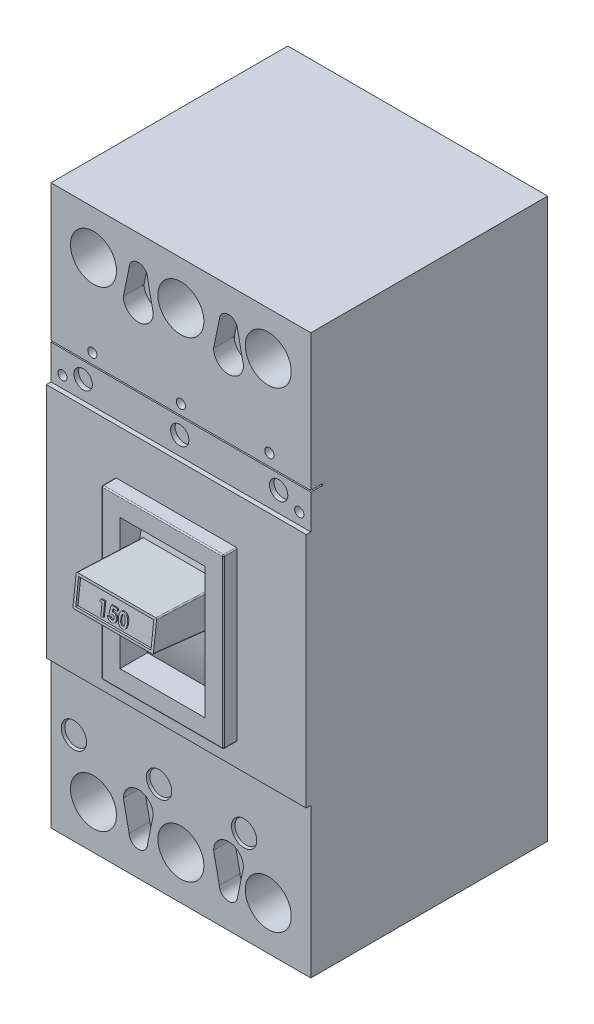
from build123d import *

# Parameters (mm, degrees)
CROQUIS1_W              = 113
CROQUIS1_H              = 243
SALIENTE_EXTRUIR1_DEPTH = 105
CROQUIS2_W              = 113
CROQUIS2_H              = 65
CORTAR_EXTRUIR1_DEPTH   = 2
CROQUIS3_W              = 113
CROQUIS3_H              = 75
CORTAR_EXTRUIR2_DEPTH   = 2
CROQUIS4_W              = 53
CROQUIS4_H              = 73
SALIENTE_EXTRUIR2_DEPTH = 6
CROQUIS5_W              = 37
CROQUIS5_H              = 57
CORTAR_EXTRUIR3_DEPTH   = 7
CORTAR_EXTRUIR4_DEPTH   = 37
SALIENTE_EXTRUIR3_DEPTH = 37
CORTAR_EXTRUIR5_DEPTH   = 1
CORTAR_EXTRUIR6_START   = -1
CORTAR_EXTRUIR6_DEPTH   = 1
CROQUIS11_W             = 32.724910956
CROQUIS11_H             = 10.881126431
CORTAR_EXTRUIR7_DEPTH   = 1
REDONDEO1_R             = 0.5
SALIENTE_EXTRUIR4_DEPTH = 0.5
REDONDEO2_R             = 0.5
CROQUIS13_R             = 10
CORTAR_EXTRUIR8_DEPTH   = 39
CORTAR_EXTRUIR9_DEPTH   = 9
CROQUIS15_R             = 3.5
CROQUIS15_R_2           = 2.5
CORTAR_EXTRUIR10_DEPTH  = 94
CROQUIS16_R             = 3.5
CROQUIS16_R_2           = 2.5
CORTAR_EXTRUIR11_DEPTH  = 94
CROQUIS17_R             = 4
CORTAR_EXTRUIR12_DEPTH  = 2
CROQUIS18_R             = 2
CORTAR_EXTRUIR13_DEPTH  = 10
CROQUIS19_W             = 113
CROQUIS19_H             = 0.6
CORTAR_EXTRUIR14_DEPTH  = 5
CROQUIS20_R             = 5.5
CORTAR_EXTRUIR15_DEPTH  = 5
CROQUIS21_R             = 5
SALIENTE_EXTRUIR5_DEPTH = 4


with BuildPart() as part:
    # Croquis1 → Saliente-Extruir1 (new body)
    with BuildSketch(Plane.XY):
        Rectangle(CROQUIS1_W, CROQUIS1_H)
    extrude(amount=SALIENTE_EXTRUIR1_DEPTH)

    # Croquis2 → Cortar-Extruir1 (cut)
    with BuildSketch(Plane.XY.offset(105)):
        with Locations((0, -89)):
            Rectangle(CROQUIS2_W, CROQUIS2_H)
    extrude(amount=-CORTAR_EXTRUIR1_DEPTH, mode=Mode.SUBTRACT)

    # Croquis3 → Cortar-Extruir2 (cut)
    with BuildSketch(Plane.XY.offset(105)):
        with Locations((0, 84)):
            Rectangle(CROQUIS3_W, CROQUIS3_H)
    extrude(amount=-CORTAR_EXTRUIR2_DEPTH, mode=Mode.SUBTRACT)

    # Croquis4 → Saliente-Extruir2 (add)
    with BuildSketch(Plane.XY.offset(105)):
        with Locations((0, -10)):
            Rectangle(CROQUIS4_W, CROQUIS4_H)
    extrude(amount=SALIENTE_EXTRUIR2_DEPTH)

    # Croquis5 → Cortar-Extruir3 (cut)
    with BuildSketch(Plane.XY.offset(111)):
        with Locations((0, -10)):
            Rectangle(CROQUIS5_W, CROQUIS5_H)
    extrude(amount=-CORTAR_EXTRUIR3_DEPTH, mode=Mode.SUBTRACT)

    # Croquis6 → Cortar-Extruir4 (cut)
    with BuildSketch(Plane(origin=(-18.5, 0, 0), x_dir=(0, 0, -1), z_dir=(1, 0, 0))):
        with BuildLine():
            Line((-104, 18.5), (-99, 18.5))
            ThreePointArc((-99, 18.5), (-104, -10), (-99, -38.5))
            Line((-99, -38.5), (-104, -38.5))
            Line((-104, -38.5), (-106.9692162, -38.5))
            Line((-106.9692162, -38.5), (-106.9692162, 18.5))
            Line((-106.9692162, 18.5), (-104, 18.5))
        make_face()
    extrude(amount=CORTAR_EXTRUIR4_DEPTH, mode=Mode.SUBTRACT)

    # Croquis7 → Saliente-Extruir3 (add)
    with BuildSketch(Plane(origin=(-18.5, 0, 0), x_dir=(0, 0, -1), z_dir=(1, 0, 0))):
        with BuildLine():
            Line((-102.227649558, 7.135893771), (-131, 8.457991718))
            Line((-131, 8.457991718), (-132.497021742, -4.45552546))
            Line((-132.497021742, -4.45552546), (-103.9700983, -7.762558242))
            ThreePointArc((-103.9700983, -7.762558242), (-103.433192986, -0.274231943), (-102.227649558, 7.135893771))
        make_face()
    extrude(amount=SALIENTE_EXTRUIR3_DEPTH)

    # Croquis9 → Cortar-Extruir5 (cut)
    with BuildSketch(Plane(origin=(18.5, 0, 0), x_dir=(0, 0, -1), z_dir=(1, 0, 0))):
        with BuildLine():
            Line((-131, 8.457991718), (-102.227649558, 7.135893771))
            ThreePointArc((-102.227649558, 7.135893771), (-103.52546689, -0.263440047), (-103.9700983, -7.762558242))
            Line((-103.9700983, -7.762558242), (-132.497021742, -4.45552546))
            Line((-132.497021742, -4.45552546), (-131, 8.457991718))
        make_face()
    extrude(amount=-CORTAR_EXTRUIR5_DEPTH, mode=Mode.SUBTRACT)

    # Croquis10 → Cortar-Extruir6 (cut)
    with BuildSketch(Plane.ZY.offset(18.5).offset(CORTAR_EXTRUIR6_START)):
        with BuildLine():
            Line((102.227649558, 7.135893771), (131, 8.457991718))
            Line((131, 8.457991718), (132.497021742, -4.45552546))
            Line((132.497021742, -4.45552546), (103.9700983, -7.762558242))
            ThreePointArc((103.9700983, -7.762558242), (103.52546689, -0.263440047), (102.227649558, 7.135893771))
        make_face()
    extrude(amount=CORTAR_EXTRUIR6_DEPTH, mode=Mode.SUBTRACT)

    # Croquis11 → Cortar-Extruir7 (cut)
    with BuildSketch(Plane(origin=(0, 15.097176807, 130.230341022), x_dir=(1, 0, 0), z_dir=(0, 0.11515551864956705, 0.9933474752192957))):
        with Locations((0, -13.183648225)):
            Rectangle(CROQUIS11_W, CROQUIS11_H)
    extrude(amount=-CORTAR_EXTRUIR7_DEPTH, mode=Mode.SUBTRACT)

    # Redondeo1
    # the kernel refuses this fillet: 0.5 mm, written as the material it takes off along each edge
    with BuildSketch(Plane(origin=(17.5, 8.515369043, 132.248682443), x_dir=(-1, 0, 0), z_dir=(0, -0.04590185976263014, -0.9989459541288167))) as redondeo1_piece_1_section:
        with BuildLine():
            CenterArc((REDONDEO1_R, -REDONDEO1_R), REDONDEO1_R, 90, 90)
            Line((0, -REDONDEO1_R), (0, 0))
            Line((0, 0), (REDONDEO1_R, 0))
        make_face()
    redondeo1_piece_1 = extrude(amount=31.302709819, mode=Mode.PRIVATE)
    redondeo1_piece_1 = redondeo1_piece_1 - Plane(origin=(17.386760277, -7.895107105, 38.27245671), x_dir=(0, 0.2287901044943887, 0.9734757768354829), z_dir=(1, 0, 0)) * Cylinder(65.697775302, 65, mode=Mode.PRIVATE)
    add(redondeo1_piece_1, mode=Mode.SUBTRACT)
    with BuildSketch(Plane(origin=(17.5, -7.90650264, 102.728413956), x_dir=(-1, 0, 0), z_dir=(0, 0.11515551864956763, 0.9933474752192957))) as redondeo1_piece_2_section:
        with BuildLine():
            CenterArc((REDONDEO1_R, -REDONDEO1_R), REDONDEO1_R, 90, 90)
            Line((0, -REDONDEO1_R), (0, 0))
            Line((0, 0), (REDONDEO1_R, 0))
        make_face()
    redondeo1_piece_2 = extrude(amount=31.217970453, mode=Mode.PRIVATE)
    redondeo1_piece_2 = redondeo1_piece_2 - Plane(origin=(17.38677693, -7.895107105, 38.27245671), x_dir=(0, 0.2287901044943887, 0.9734757768354829), z_dir=(1, 0, 0)) * Cylinder(65.697775302, 65, mode=Mode.PRIVATE)
    add(redondeo1_piece_2, mode=Mode.SUBTRACT)
    with BuildSketch(Plane(origin=(-17.5, 7.078516447, 100.978967116), x_dir=(1, 0, 0), z_dir=(0, 0.04590185976263014, 0.9989459541288167))) as redondeo1_piece_3_section:
        with BuildLine():
            CenterArc((REDONDEO1_R, -REDONDEO1_R), REDONDEO1_R, 90, 90)
            Line((0, -REDONDEO1_R), (0, 0))
            Line((0, 0), (REDONDEO1_R, 0))
        make_face()
    redondeo1_piece_3 = extrude(amount=31.302709819, mode=Mode.PRIVATE)
    redondeo1_piece_3 = redondeo1_piece_3 - Plane(origin=(-17.386760284, -7.895107105, 38.27245671), x_dir=(0, 0.002017554823552003, 0.9999979647341959), z_dir=(1, 0, 0)) * Cylinder(65.697775302, 65, mode=Mode.PRIVATE)
    add(redondeo1_piece_3, mode=Mode.SUBTRACT)
    with BuildSketch(Plane(origin=(-17.5, -4.311581061, 133.738706086), x_dir=(1, 0, 0), z_dir=(0, -0.11515551864956758, -0.9933474752192957))) as redondeo1_piece_4_section:
        with BuildLine():
            CenterArc((REDONDEO1_R, -REDONDEO1_R), REDONDEO1_R, 90, 90)
            Line((0, -REDONDEO1_R), (0, 0))
            Line((0, 0), (REDONDEO1_R, 0))
        make_face()
    redondeo1_piece_4 = extrude(amount=31.217970453, mode=Mode.PRIVATE)
    redondeo1_piece_4 = redondeo1_piece_4 - Plane(origin=(-17.386776917, -7.895107105, 38.27245671), x_dir=(0, 0.002017554823552003, 0.9999979647341959), z_dir=(1, 0, 0)) * Cylinder(65.697775302, 65, mode=Mode.PRIVATE)
    add(redondeo1_piece_4, mode=Mode.SUBTRACT)

    # Croquis12 → Saliente-Extruir4 (add)
    # profile 1 of 3: a face of its own
    with BuildSketch(Plane(origin=(0, 14.982021289, 129.236993547), x_dir=(1, 0, 0), z_dir=(0, 0.11515551864956658, 0.9933474752192957))):
        Polygon((-6.662487166, -11.457476936), (-5.047532405, -11.457476936), (-5.047532405, -17.27831027), (-6.092297363, -17.27831027), (-6.092297363, -12.427615825), (-7.286314457, -12.427615825), align=None)
    # profile 2 of 3: a face of its own
    with BuildSketch(Plane(origin=(0, 14.982021289, 129.236993547), x_dir=(1, 0, 0), z_dir=(0, 0.11515551864956658, 0.9933474752192957))):
        with BuildLine():
            Line((-2.175594805, -11.457476936), (0.474796655, -11.457476936))
            Line((0.474796655, -11.457476936), (0.474796655, -12.427615825))
            Line((0.474796655, -12.427615825), (-1.347711859, -12.427615825))
            Line((-1.347711859, -12.427615825), (-1.575088161, -13.528350334))
            add(Edge.make_bspline(
                [(-1.575088161, -13.528350334), (-1.544104885, -13.5197211), (-1.482999499, -13.502702479), (-1.390944159, -13.485634955), (-1.301729706, -13.474572328), (-1.243187726, -13.473096721), (-1.214784175, -13.472380782)],
                knots=[0, 0, 0, 0, 1.05461699, 2.079921384, 3.068411212, 4, 4, 4, 4], degree=3))
            add(Edge.make_bspline(
                [(-1.214784175, -13.472380782), (-1.15288986, -13.473799055), (-1.030882532, -13.476594782), (-0.852401294, -13.503135352), (-0.681494964, -13.544935946), (-0.518686535, -13.604552218), (-0.36413505, -13.682144335), (-0.217653161, -13.776009046), (-0.079061086, -13.886311212), (0.049179195, -14.01311989), (0.167011722, -14.15235869), (0.269460384, -14.302960185), (0.356957935, -14.462776945), (0.426550462, -14.632802387), (0.481478817, -14.811968637), (0.521171273, -15.000390509), (0.544643405, -15.198291313), (0.547808478, -15.333304882), (0.549422723, -15.402164269)],
                knots=[0, 0, 0, 0, 1.01440847, 1.999622559, 2.951875003, 3.895578053, 4.836219714, 5.782137149, 6.743708247, 7.735272588, 8.734977101, 9.730283169, 10.717124674, 11.717316708, 12.737475749, 13.78628267, 14.87096371, 16, 16, 16, 16], degree=3))
            add(Edge.make_bspline(
                [(0.549422723, -15.402164269), (0.547450089, -15.47180537), (0.543557507, -15.609227619), (0.518161973, -15.811286935), (0.4733384, -16.004814144), (0.411768737, -16.190327314), (0.330654647, -16.366462967), (0.233103853, -16.535045738), (0.117467033, -16.69482429), (-0.015121018, -16.8441607), (-0.159261623, -16.980657045), (-0.312737341, -17.100733142), (-0.47446996, -17.201776204), (-0.644463381, -17.283436081), (-0.8217423, -17.348043922), (-1.006360521, -17.395075346), (-1.199215266, -17.422045255), (-1.33013858, -17.425703147), (-1.396685216, -17.427562406)],
                knots=[0, 0, 0, 0, 1.06808661, 2.107647099, 3.116961351, 4.110378221, 5.100014249, 6.085620622, 7.093190682, 8.119403071, 9.144090782, 10.133780668, 11.103064255, 12.062861538, 13.020824475, 13.992378307, 14.979551724, 16, 16, 16, 16], degree=3))
            add(Edge.make_bspline(
                [(-1.396685216, -17.427562406), (-1.456195892, -17.426041416), (-1.573563399, -17.423041706), (-1.746440584, -17.404603905), (-1.913113387, -17.372005699), (-2.072696959, -17.324827655), (-2.226870386, -17.266762253), (-2.373851378, -17.194140494), (-2.514447622, -17.108345195), (-2.648259877, -17.010942122), (-2.773113884, -16.901221338), (-2.887067392, -16.781113036), (-2.99081029, -16.652131122), (-3.082122642, -16.512684351), (-3.160718212, -16.362978747), (-3.230418367, -16.204778627), (-3.287468641, -16.036431876), (-3.316420013, -15.919724555), (-3.331132833, -15.86041497)],
                knots=[0, 0, 0, 0, 1.054957082, 2.080596141, 3.077793124, 4.061112343, 5.027190972, 5.994718051, 6.962465889, 7.943658696, 8.924948258, 9.904494768, 10.875059, 11.855380583, 12.854004648, 13.869083016, 14.917087635, 16, 16, 16, 16], degree=3))
            Line((-3.331132833, -15.86041497), (-2.137115739, -15.86041497))
            add(Edge.make_bspline(
                [(-2.137115739, -15.86041497), (-2.115289077, -15.901514097), (-2.072871452, -15.98138556), (-1.992183751, -16.087426929), (-1.901858992, -16.177854452), (-1.802711954, -16.253551626), (-1.694100226, -16.310262661), (-1.58044953, -16.353269687), (-1.460332121, -16.378121854), (-1.378526861, -16.381228621), (-1.337217568, -16.382797449)],
                knots=[0, 0, 0, 0, 1.104910296, 2.147267069, 3.153527244, 4.136738762, 5.099945312, 6.05603338, 7.018353, 8, 8, 8, 8], degree=3))
            add(Edge.make_bspline(
                [(-1.337217568, -16.382797449), (-1.308425545, -16.38171416), (-1.251776754, -16.37958277), (-1.168313719, -16.368307183), (-1.088644585, -16.346951476), (-1.012177031, -16.317378788), (-0.938705646, -16.280498304), (-0.869283668, -16.233939097), (-0.80270328, -16.180347724), (-0.739978104, -16.118851441), (-0.683167175, -16.050297391), (-0.633350204, -15.97663139), (-0.588806962, -15.899490313), (-0.555813102, -15.815818409), (-0.528793921, -15.728114151), (-0.508895902, -15.635715957), (-0.497004592, -15.538515916), (-0.495903775, -15.472160172), (-0.495342234, -15.438311271)],
                knots=[0, 0, 0, 0, 0.978869489, 1.925942215, 2.855067702, 3.774946051, 4.70828698, 5.642468714, 6.60995405, 7.609372294, 8.622401667, 9.629904756, 10.629323, 11.642352373, 12.678539694, 13.745912462, 14.850161547, 16, 16, 16, 16], degree=3))
            add(Edge.make_bspline(
                [(-0.495342234, -15.438311271), (-0.495993967, -15.40524808), (-0.497262581, -15.340889776), (-0.50775681, -15.246388733), (-0.526530783, -15.156724345), (-0.552110483, -15.071209851), (-0.584855551, -14.990364535), (-0.624872215, -14.913707168), (-0.672331427, -14.841625224), (-0.727487988, -14.775586222), (-0.786306377, -14.71501337), (-0.849496226, -14.662036837), (-0.91648823, -14.618069993), (-0.985200693, -14.579685659), (-1.05837637, -14.551750377), (-1.134369834, -14.532512379), (-1.213101168, -14.51839631), (-1.266802103, -14.517566939), (-1.294074372, -14.51714574)],
                knots=[0, 0, 0, 0, 1.166249705, 2.270133367, 3.348514167, 4.393962215, 5.415026464, 6.420877785, 7.440098956, 8.453121383, 9.451844239, 10.415694839, 11.355045125, 12.27538808, 13.187007209, 14.108269027, 15.039275622, 16, 16, 16, 16], degree=3))
            add(Edge.make_bspline(
                [(-1.294074372, -14.51714574), (-1.323698396, -14.518269807), (-1.383071293, -14.520522679), (-1.471284559, -14.538853693), (-1.558434218, -14.568520151), (-1.645004912, -14.609449732), (-1.730137276, -14.663013638), (-1.816077997, -14.725837959), (-1.899950453, -14.802487478), (-1.953278893, -14.859576213), (-1.980867408, -14.889110049)],
                knots=[0, 0, 0, 0, 0.88288272, 1.769486374, 2.674910571, 3.623812639, 4.617874466, 5.670434592, 6.794841017, 8, 8, 8, 8], degree=3))
            Line((-1.980867408, -14.889110049), (-2.860055776, -14.687386458))
            Line((-2.860055776, -14.687386458), (-2.175594805, -11.457476936))
        make_face()
    # profile 3 of 3: a face of its own
    with BuildSketch(Plane(origin=(0, 14.982021289, 129.236993547), x_dir=(1, 0, 0), z_dir=(0, 0.11515551864956658, 0.9933474752192957))):
        with BuildLine():
            add(Edge.make_bspline(
                [(3.181157666, -11.308224799), (3.231728626, -11.30897554), (3.331164645, -11.310451695), (3.477615184, -11.326439664), (3.618687545, -11.350593027), (3.754933619, -11.384278544), (3.885372693, -11.428860127), (4.010954131, -11.482223518), (4.130183149, -11.547167736), (4.244580299, -11.620525566), (4.354101515, -11.703577029), (4.45611453, -11.798259985), (4.55248232, -11.902395775), (4.641118876, -12.017558745), (4.723987083, -12.142701367), (4.800814648, -12.277843484), (4.871013439, -12.423646525), (4.935370215, -12.580373605), (4.992918248, -12.750373995), (5.041390884, -12.935597672), (5.082964281, -13.136086935), (5.118055162, -13.352340834), (5.144578195, -13.58464682), (5.162455254, -13.832850562), (5.174723338, -14.096473559), (5.175724574, -14.277316769), (5.176238962, -14.370225668)],
                knots=[0, 0, 0, 0, 0.879237366, 1.728815576, 2.559023295, 3.367336655, 4.166867292, 4.954216142, 5.737608147, 6.525189134, 7.316157332, 8.124696809, 8.942788509, 9.781158001, 10.649253743, 11.551476218, 12.482711956, 13.461909668, 14.496590415, 15.601789533, 16.789733467, 18.056700938, 19.410929216, 20.8549011, 22.384193279, 24, 24, 24, 24], degree=3))
            add(Edge.make_bspline(
                [(5.176238962, -14.370225668), (5.175683047, -14.464296961), (5.174602914, -14.647075796), (5.162965242, -14.913110023), (5.142924621, -15.163115873), (5.117094822, -15.397067481), (5.081715063, -15.614841302), (5.040280447, -15.817001223), (4.991042685, -16.003473965), (4.931599038, -16.173839368), (4.867631815, -16.330841695), (4.797241, -16.476360455), (4.721653497, -16.610789794), (4.642603055, -16.736157762), (4.555755836, -16.848768574), (4.465338942, -16.952451586), (4.367415457, -17.04325738), (4.266108341, -17.12586568), (4.157706302, -17.197255828), (4.043327264, -17.259692474), (3.920932046, -17.310336011), (3.792751705, -17.354383053), (3.65660138, -17.386004077), (3.514644483, -17.411094321), (3.365278348, -17.424960728), (3.263583867, -17.426680947), (3.211474506, -17.427562406)],
                knots=[0, 0, 0, 0, 1.643780988, 3.193836972, 4.651895693, 6.025988579, 7.305620092, 8.505800249, 9.631074763, 10.672816429, 11.65661981, 12.592235626, 13.49536222, 14.350718032, 15.179365177, 15.97804903, 16.751647189, 17.51006938, 18.259804725, 19.016521909, 19.783502495, 20.571750527, 21.382245291, 22.22305063, 23.089471752, 24, 24, 24, 24], degree=3))
            add(Edge.make_bspline(
                [(3.211474506, -17.427562406), (3.159366551, -17.426663945), (3.057287833, -17.424903871), (2.907517797, -17.411197423), (2.764808599, -17.385902436), (2.627581107, -17.35414029), (2.496790402, -17.310433469), (2.371809347, -17.258274715), (2.253598937, -17.196227642), (2.141831868, -17.124671161), (2.036889742, -17.042615574), (1.937141761, -16.950938557), (1.842808573, -16.849872487), (1.755325219, -16.738285342), (1.673258975, -16.617666577), (1.597465662, -16.486638784), (1.527990831, -16.345392736), (1.462661295, -16.193731551), (1.405898198, -16.028390138), (1.355381677, -15.847892019), (1.313999871, -15.650732592), (1.280717855, -15.436975199), (1.254145512, -15.207072692), (1.234378743, -14.960914105), (1.222676429, -14.698384784), (1.221607623, -14.517935304), (1.221057338, -14.425029187)],
                knots=[0, 0, 0, 0, 0.917216111, 1.796812873, 2.643793957, 3.46689424, 4.273913431, 5.068098542, 5.848489301, 6.620921603, 7.401012384, 8.190319798, 9.003608147, 9.831726257, 10.68377682, 11.569763213, 12.493818149, 13.453288342, 14.474581811, 15.568529029, 16.750744269, 18.018426408, 19.375425659, 20.823733699, 22.36466933, 24, 24, 24, 24], degree=3))
            add(Edge.make_bspline(
                [(1.221057338, -14.425029187), (1.222054127, -14.295943451), (1.223977445, -14.046870861), (1.248351137, -13.687033385), (1.284125536, -13.354425973), (1.336669653, -13.049604993), (1.401639728, -12.771441477), (1.484837291, -12.521767821), (1.579551664, -12.297129231), (1.660260479, -12.164051978), (1.699130589, -12.099960744)],
                knots=[0, 0, 0, 0, 1.288568992, 2.486310467, 3.599230591, 4.627010532, 5.572937695, 6.447898582, 7.252493626, 8, 8, 8, 8], degree=3))
            add(Edge.make_bspline(
                [(1.699130589, -12.099960744), (1.744326902, -12.036997535), (1.832694599, -11.913892057), (1.987207987, -11.752277574), (2.153212506, -11.614056955), (2.334117793, -11.502358255), (2.527062755, -11.414272652), (2.733703924, -11.352058782), (2.953278209, -11.315810082), (3.104063532, -11.310790984), (3.181157666, -11.308224799)],
                knots=[0, 0, 0, 0, 1.058512271, 2.069600068, 3.047294572, 4.004278952, 4.967380941, 5.939006123, 6.946246673, 8, 8, 8, 8], degree=3))
        make_face()
        with BuildLine():
            add(Edge.make_bspline(
                [(3.206810377, -12.352989757), (3.161093809, -12.355156631), (3.071465069, -12.359404855), (2.941409497, -12.395466284), (2.818775213, -12.451165105), (2.725490588, -12.518189928), (2.655667975, -12.582441258), (2.606882414, -12.640586622), (2.559836429, -12.705472658), (2.518283047, -12.780027339), (2.479045807, -12.861571827), (2.440699196, -12.950476285), (2.409265045, -13.0489244), (2.378381824, -13.155239586), (2.351325242, -13.272361176), (2.328657757, -13.401246511), (2.308406352, -13.542733743), (2.294280755, -13.696915547), (2.28111146, -13.863630611), (2.271671086, -14.04325031), (2.267724302, -14.235726188), (2.26646974, -14.368281468), (2.265822296, -14.43668951)],
                knots=[0, 0, 0, 0, 1.076674018, 2.110852608, 3.161083442, 4.239746716, 4.804137807, 5.395870207, 6.026861976, 6.692161227, 7.405688833, 8.16177676, 8.973626916, 9.841385931, 10.773283133, 11.807421078, 12.927755683, 14.143907515, 15.458935494, 16.872852025, 18.386167141, 20, 20, 20, 20], degree=3))
            add(Edge.make_bspline(
                [(2.265822296, -14.43668951), (2.26688791, -14.525315434), (2.268931305, -14.695262215), (2.279633655, -14.939651604), (2.301085625, -15.162065626), (2.327767545, -15.364011665), (2.365243391, -15.544180045), (2.408361778, -15.704275328), (2.461609152, -15.842256686), (2.523146752, -15.96011964), (2.591302418, -16.060385411), (2.665288391, -16.145611767), (2.742585714, -16.219413771), (2.825607088, -16.27936223), (2.914154449, -16.325303965), (3.007488589, -16.358349287), (3.105668821, -16.378577705), (3.172901632, -16.381382737), (3.206810377, -16.382797449)],
                knots=[0, 0, 0, 0, 1.771748488, 3.397459088, 4.888034009, 6.237357457, 7.467047327, 8.564189669, 9.548206622, 10.417051504, 11.216568818, 11.965764335, 12.669334354, 13.348544111, 14.005342236, 14.656555988, 15.322436492, 16, 16, 16, 16], degree=3))
            add(Edge.make_bspline(
                [(3.206810377, -16.382797449), (3.23955548, -16.381829398), (3.303666321, -16.379934074), (3.397154285, -16.360478827), (3.485563147, -16.328848821), (3.568625973, -16.284105957), (3.646639867, -16.22720856), (3.719223545, -16.157906598), (3.785829595, -16.075509292), (3.824634582, -16.014358305), (3.844630055, -15.982848364)],
                knots=[0, 0, 0, 0, 0.992283464, 1.942767638, 2.88273346, 3.832339453, 4.79467288, 5.803907806, 6.868395428, 8, 8, 8, 8], degree=3))
            add(Edge.make_bspline(
                [(3.844630055, -15.982848364), (3.868171356, -15.939791036), (3.917535555, -15.849503311), (3.974659892, -15.697146142), (4.022743975, -15.525312436), (4.064129242, -15.333467431), (4.092434241, -15.120854467), (4.11681047, -14.88882174), (4.128567732, -14.636200828), (4.130480114, -14.461184148), (4.131474005, -14.370225668)],
                knots=[0, 0, 0, 0, 0.710965849, 1.490837728, 2.352621235, 3.297892224, 4.334225155, 5.461620853, 6.680770821, 8, 8, 8, 8], degree=3))
            add(Edge.make_bspline(
                [(4.131474005, -14.370225668), (4.131090087, -14.278477623), (4.130351109, -14.101878301), (4.116793013, -13.848349199), (4.097912328, -13.61679244), (4.070295337, -13.407724999), (4.034761058, -13.220639349), (3.990964925, -13.055547722), (3.939332542, -12.912124752), (3.878102689, -12.790513454), (3.810286823, -12.687160532), (3.738298211, -12.598491742), (3.661832455, -12.522788567), (3.581017432, -12.459766121), (3.49398265, -12.411612245), (3.402390586, -12.377611626), (3.30605347, -12.357042391), (3.240337918, -12.354358868), (3.206810377, -12.352989757)],
                knots=[0, 0, 0, 0, 1.793836731, 3.452829483, 4.963243077, 6.335886805, 7.574563692, 8.684454726, 9.672768357, 10.54971625, 11.340229787, 12.085688095, 12.778991901, 13.440269426, 14.083255152, 14.715733572, 15.344777694, 16, 16, 16, 16], degree=3))
        make_face(mode=Mode.SUBTRACT)
    extrude(amount=SALIENTE_EXTRUIR4_DEPTH)

    # Redondeo2
    redondeo2_edges = [part.edges().sort_by_distance(p)[0] for p in [
        (26.5, -46.5, 108),
        (26.5, 26.5, 108),
        (-26.5, 26.5, 108),
        (-26.5, -46.5, 108),
        (26.5, -10, 111),
        (0, 26.5, 111),
        (-26.5, -10, 111),
        (0, -46.5, 111),
    ]]
    fillet(redondeo2_edges, radius=REDONDEO2_R)

    # Croquis13 → Cortar-Extruir8 (cut)
    with BuildSketch(Plane.XY.offset(103)):
        with Locations((0, 102.5)):
            Circle(CROQUIS13_R)
        with Locations((-38, 102.5)):
            Circle(CROQUIS13_R)
        with Locations((38, 102.5)):
            Circle(CROQUIS13_R)
        with Locations(Location((38, -102.5, 0), (0, 0, 180))):
            Circle(CROQUIS13_R)
        with Locations(Location((-38, -102.5, 0), (0, 0, 180))):
            Circle(CROQUIS13_R)
        with Locations(Location((0, -102.5, 0), (0, 0, 180))):
            Circle(CROQUIS13_R)
    extrude(amount=-CORTAR_EXTRUIR8_DEPTH, mode=Mode.SUBTRACT)

    # Croquis14 → Cortar-Extruir9 (cut)
    with BuildSketch(Plane.XY.offset(103)):
        with BuildLine():
            Line((-25, 94.5), (-22.5, 106.5))
            ThreePointArc((-22.5, 106.5), (-18.5, 110.5), (-14.5, 106.5))
            Line((-14.5, 106.5), (-12, 94.5))
            ThreePointArc((-12, 94.5), (-18.5, 88), (-25, 94.5))
        make_face()
        with BuildLine():
            Line((14.223425722, 94.5), (16.723425722, 106.5))
            ThreePointArc((16.723425722, 106.5), (20.723425722, 110.5), (24.723425722, 106.5))
            Line((24.723425722, 106.5), (27.223425722, 94.5))
            ThreePointArc((27.223425722, 94.5), (20.723425722, 88), (14.223425722, 94.5))
        make_face()
        with BuildLine():
            Line((24.723425722, -106.5), (27.223425722, -94.5))
            ThreePointArc((27.223425722, -94.5), (20.723425722, -88), (14.223425722, -94.5))
            Line((14.223425722, -94.5), (16.723425722, -106.5))
            ThreePointArc((16.723425722, -106.5), (20.723425722, -110.5), (24.723425722, -106.5))
        make_face()
        with BuildLine():
            Line((-12, -94.5), (-14.5, -106.5))
            ThreePointArc((-14.5, -106.5), (-18.5, -110.5), (-22.5, -106.5))
            Line((-22.5, -106.5), (-25, -94.5))
            ThreePointArc((-25, -94.5), (-18.5, -88), (-12, -94.5))
        make_face()
    extrude(amount=-CORTAR_EXTRUIR9_DEPTH, mode=Mode.SUBTRACT)

    # Croquis15 → Cortar-Extruir10 (cut)
    with BuildSketch(Plane.XY.offset(94)):
        with Locations((-18.5, 94.5)):
            Circle(CROQUIS15_R)
        with Locations((20.723425722, 94.5)):
            Circle(CROQUIS15_R)
        with Locations((-18.5, 106.5)):
            Circle(CROQUIS15_R_2)
        with Locations((20.723425722, 106.5)):
            Circle(CROQUIS15_R_2)
    extrude(amount=-CORTAR_EXTRUIR10_DEPTH, mode=Mode.SUBTRACT)

    # Croquis16 → Cortar-Extruir11 (cut)
    with BuildSketch(Plane.XY.offset(94)):
        with Locations((-18.5, -94.5)):
            Circle(CROQUIS16_R)
        with Locations((-18.5, -106.5)):
            Circle(CROQUIS16_R_2)
        with Locations((20.723425722, -94.5)):
            Circle(CROQUIS16_R)
        with Locations((20.723425722, -106.5)):
            Circle(CROQUIS16_R_2)
    extrude(amount=-CORTAR_EXTRUIR11_DEPTH, mode=Mode.SUBTRACT)

    # Croquis17 → Cortar-Extruir12 (cut)
    with BuildSketch(Plane.XY.offset(103)):
        with Locations((-42.5, 54.5)):
            Circle(CROQUIS17_R)
        with Locations((-0.5, 54.5)):
            Circle(CROQUIS17_R)
        with Locations((42.5, 55.253225153)):
            Circle(CROQUIS17_R)
    extrude(amount=-CORTAR_EXTRUIR12_DEPTH, mode=Mode.SUBTRACT)

    # Croquis18 → Cortar-Extruir13 (cut)
    with BuildSketch(Plane.XY.offset(103)):
        with Locations((-51.5, 51.5)):
            Circle(CROQUIS18_R)
        with Locations((51.5, 51.5)):
            Circle(CROQUIS18_R)
        with Locations((0, 66.5)):
            Circle(CROQUIS18_R)
        with Locations((38.5, 67.253225153)):
            Circle(CROQUIS18_R)
        with Locations((-38.5, 66.5)):
            Circle(CROQUIS18_R)
    extrude(amount=-CORTAR_EXTRUIR13_DEPTH, mode=Mode.SUBTRACT)

    # Croquis19 → Cortar-Extruir14 (cut)
    with BuildSketch(Plane.XY.offset(103)):
        with Locations((0, 61.8)):
            Rectangle(CROQUIS19_W, CROQUIS19_H)
    extrude(amount=-CORTAR_EXTRUIR14_DEPTH, mode=Mode.SUBTRACT)

    # Croquis20 → Cortar-Extruir15 (cut)
    with BuildSketch(Plane.XY.offset(103)):
        with Locations((-9.5, -81.5)):
            Circle(CROQUIS20_R)
        with Locations((27.5, -81.5)):
            Circle(CROQUIS20_R)
        with Locations((-46.5, -81.5)):
            Circle(CROQUIS20_R)
    extrude(amount=-CORTAR_EXTRUIR15_DEPTH, mode=Mode.SUBTRACT)

    # Croquis21 → Saliente-Extruir5 (add)
    with BuildSketch(Plane.XY.offset(98)):
        with Locations((-46.5, -81.5)):
            Circle(CROQUIS21_R)
        with Locations((-9.5, -81.5)):
            Circle(CROQUIS21_R)
        with Locations((27.5, -81.5)):
            Circle(CROQUIS21_R)
    extrude(amount=SALIENTE_EXTRUIR5_DEPTH)


solid = part.part
